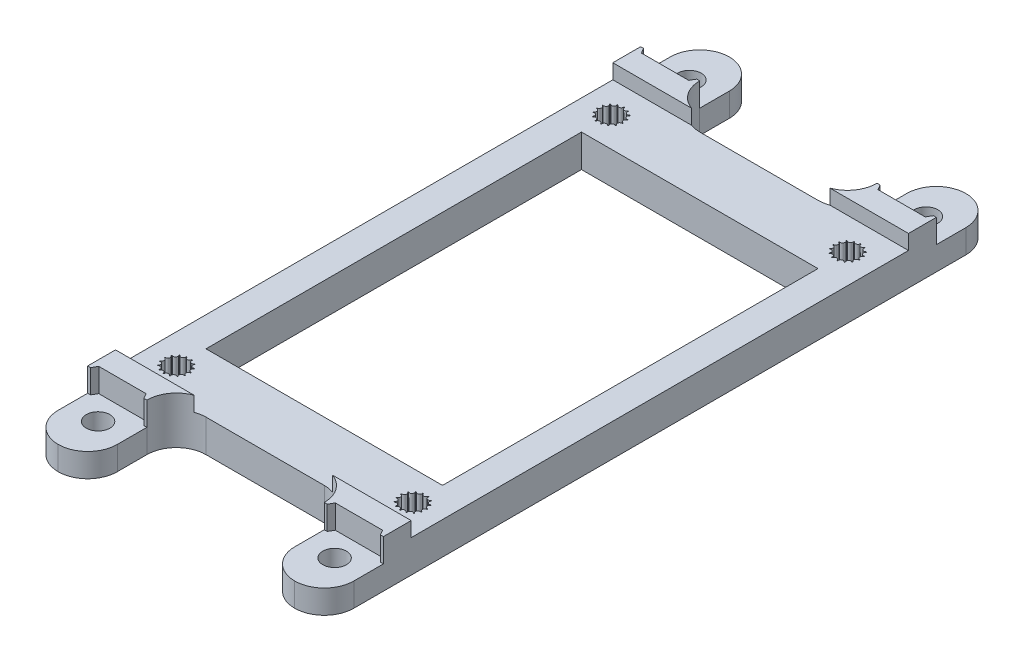
from build123d import *

# Parameters (mm, degrees)
SKETCH1_W                                  = 50
SKETCH1_H                                  = 83.5
BOSS_EXTRUDE1_DEPTH                        = 8
CUT_EXTRUDE1_DEPTH                         = 8
MIRROR1_AT_THE_SECOND_PLANE_COPY_1_DEPTH   = 8
SKETCH3_W                                  = 10
SKETCH3_H                                  = 15
SKETCH3_R                                  = 2
BOSS_EXTRUDE2_DEPTH                        = 8
MIRROR2_AT_THE_SECOND_PLANE_COPY_1_SKETC_W = 10
MIRROR2_AT_THE_SECOND_PLANE_COPY_1_SKETC_H = 15
MIRROR2_AT_THE_SECOND_PLANE_COPY_1_SKETC_R = 2
MIRROR2_AT_THE_SECOND_PLANE_COPY_1_DEPTH   = 8
FILLET1_R                                  = 5
CUT_EXTRUDE2_DEPTH                         = 4
MIRROR4_AT_THE_SECOND_PLANE_COPY_1_DEPTH   = 4
SKETCH5_W                                  = 40
SKETCH5_H                                  = 63.5
CUT_EXTRUDE3_DEPTH                         = 13
SKETCH6_W                                  = 51.1
SKETCH6_H                                  = 84.1
CUT_EXTRUDE4_DEPTH                         = 2.5


with BuildPart() as part:
    # Sketch1 → Boss-Extrude1 (new body)
    with BuildSketch(Plane(origin=(0, 0, 0), x_dir=(1, 0, 0), z_dir=(0, 1, 0))):
        with Locations((25, 41.75)):
            Rectangle(SKETCH1_W, SKETCH1_H)
    extrude(amount=BOSS_EXTRUDE1_DEPTH)

    # Sketch2 → Cut-Extrude1 (cut)
    with BuildSketch(Plane(origin=(0, 8, 0), x_dir=(1, 0, 0), z_dir=(0, 1, 0))):
        with BuildLine():
            ThreePointArc((7.160667609, 4.372293474), (6.839865506, 4.806622343), (7.243959363, 5.164761577))
            ThreePointArc((7.243959363, 5.164761577), (7.237674265, 5.235189042), (7.229179325, 5.305384245))
            ThreePointArc((7.229179325, 5.305384245), (6.759454555, 5.57168144), (6.982944313, 6.063217688))
            ThreePointArc((6.982944313, 6.063217688), (6.948557159, 6.125), (6.912245684, 6.185671305))
            ThreePointArc((6.912245684, 6.185671305), (6.374817927, 6.237891622), (6.379060176, 6.777833803))
            ThreePointArc((6.379060176, 6.777833803), (6.322516818, 6.820288237), (6.264667392, 6.860945025))
            ThreePointArc((6.264667392, 6.860945025), (5.75246279, 6.690059097), (5.536724007, 7.185046302))
            ThreePointArc((5.536724007, 7.185046302), (5.467801304, 7.200832102), (5.398416619, 7.214444444))
            ThreePointArc((5.398416619, 7.214444444), (5, 6.85), (4.601583381, 7.214444444))
            ThreePointArc((4.601583381, 7.214444444), (4.532198696, 7.200832102), (4.463275993, 7.185046302))
            ThreePointArc((4.463275993, 7.185046302), (4.479414078, 7.121153089), (4.484842553, 7.05547728))
            ThreePointArc((4.484842553, 7.05547728), (4.185331413, 6.668305497), (3.735332608, 6.860945025))
            ThreePointArc((3.735332608, 6.860945025), (3.677483182, 6.820288237), (3.620939824, 6.777833803))
            ThreePointArc((3.620939824, 6.777833803), (3.700218564, 6.651820533), (3.727924143, 6.505543864))
            ThreePointArc((3.727924143, 6.505543864), (3.50671462, 6.147725523), (3.087754316, 6.185671305))
            ThreePointArc((3.087754316, 6.185671305), (3.051442841, 6.125), (3.017055687, 6.063217688))
            ThreePointArc((3.017055687, 6.063217688), (3.193869104, 5.915772772), (3.260122838, 5.695288237))
            ThreePointArc((3.260122838, 5.695288237), (3.109400931, 5.382461716), (2.770820675, 5.305384245))
            ThreePointArc((2.770820675, 5.305384245), (2.762325735, 5.235189042), (2.756040637, 5.164761577))
            ThreePointArc((2.756040637, 5.164761577), (3.042937532, 5.049867127), (3.162325735, 4.764810958))
            ThreePointArc((3.162325735, 4.764810958), (3.071196794, 4.510648276), (2.839332391, 4.372293474))
            ThreePointArc((2.839332391, 4.372293474), (2.860122838, 4.304711763), (2.883026546, 4.237816691))
            ThreePointArc((2.883026546, 4.237816691), (3.266656087, 4.212169481), (3.451442841, 3.875))
            ThreePointArc((3.451442841, 3.875), (3.40640772, 3.690609287), (3.281443165, 3.547738864))
            ThreePointArc((3.281443165, 3.547738864), (3.327924143, 3.494456136), (3.376056398, 3.442660224))
            ThreePointArc((3.376056398, 3.442660224), (3.817892025, 3.554258631), (4.077483182, 3.179711763))
            ThreePointArc((4.077483182, 3.179711763), (4.063028211, 3.073151777), (4.020708029, 2.974293398))
            ThreePointArc((4.020708029, 2.974293398), (4.084842553, 2.94452272), (4.149880851, 2.916781953))
            ThreePointArc((4.149880851, 2.916781953), (4.591666595, 3.194722659), (4.932198696, 2.799167898))
            ThreePointArc((4.932198696, 2.799167898), (4.931473708, 2.775095823), (4.929301372, 2.751111007))
            ThreePointArc((4.929301372, 2.751111007), (5, 2.75), (5.070698628, 2.751111007))
            ThreePointArc((5.070698628, 2.751111007), (5.384636628, 3.190426939), (5.850119149, 2.916781953))
            ThreePointArc((5.850119149, 2.916781953), (5.915157447, 2.94452272), (5.979291971, 2.974293398))
            ThreePointArc((5.979291971, 2.974293398), (6.087402717, 3.50331856), (6.623943602, 3.442660224))
            ThreePointArc((6.623943602, 3.442660224), (6.672075857, 3.494456136), (6.718556835, 3.547738864))
            ThreePointArc((6.718556835, 3.547738864), (6.602146997, 4.075), (7.116973454, 4.237816691))
            ThreePointArc((7.116973454, 4.237816691), (7.139877162, 4.304711763), (7.160667609, 4.372293474))
        make_face()
    cut_extrude1 = extrude(amount=-CUT_EXTRUDE1_DEPTH, mode=Mode.SUBTRACT)

    # Mirror1: Cut-Extrude1 across plane
    add(cut_extrude1.mirror(Plane(origin=(0, 0, -41.75), x_dir=(1, 0, 0), z_dir=(0, 0, -1))), mode=Mode.SUBTRACT)

    # Mirror1 at the second plane: Cut-Extrude1 across plane
    add(cut_extrude1.mirror(Plane.ZY.offset(-25)), mode=Mode.SUBTRACT)

    # Mirror1 at the second plane copy 1 sketc → Mirror1 at the second plane copy 1 (cut)
    with BuildSketch(Plane(origin=(50, 8, -83.5), x_dir=(-1, 0, 0), z_dir=(0, 1, 0))):
        with BuildLine():
            ThreePointArc((7.160667609, 4.372293474), (6.839865506, 4.806622343), (7.243959363, 5.164761577))
            ThreePointArc((7.243959363, 5.164761577), (7.237674265, 5.235189042), (7.229179325, 5.305384245))
            ThreePointArc((7.229179325, 5.305384245), (6.759454555, 5.57168144), (6.982944313, 6.063217688))
            ThreePointArc((6.982944313, 6.063217688), (6.948557159, 6.125), (6.912245684, 6.185671305))
            ThreePointArc((6.912245684, 6.185671305), (6.374817927, 6.237891622), (6.379060176, 6.777833803))
            ThreePointArc((6.379060176, 6.777833803), (6.322516818, 6.820288237), (6.264667392, 6.860945025))
            ThreePointArc((6.264667392, 6.860945025), (5.75246279, 6.690059097), (5.536724007, 7.185046302))
            ThreePointArc((5.536724007, 7.185046302), (5.467801304, 7.200832102), (5.398416619, 7.214444444))
            ThreePointArc((5.398416619, 7.214444444), (5, 6.85), (4.601583381, 7.214444444))
            ThreePointArc((4.601583381, 7.214444444), (4.532198696, 7.200832102), (4.463275993, 7.185046302))
            ThreePointArc((4.463275993, 7.185046302), (4.479414078, 7.121153089), (4.484842553, 7.05547728))
            ThreePointArc((4.484842553, 7.05547728), (4.185331413, 6.668305497), (3.735332608, 6.860945025))
            ThreePointArc((3.735332608, 6.860945025), (3.677483182, 6.820288237), (3.620939824, 6.777833803))
            ThreePointArc((3.620939824, 6.777833803), (3.700218564, 6.651820533), (3.727924143, 6.505543864))
            ThreePointArc((3.727924143, 6.505543864), (3.50671462, 6.147725523), (3.087754316, 6.185671305))
            ThreePointArc((3.087754316, 6.185671305), (3.051442841, 6.125), (3.017055687, 6.063217688))
            ThreePointArc((3.017055687, 6.063217688), (3.193869104, 5.915772772), (3.260122838, 5.695288237))
            ThreePointArc((3.260122838, 5.695288237), (3.109400931, 5.382461716), (2.770820675, 5.305384245))
            ThreePointArc((2.770820675, 5.305384245), (2.762325735, 5.235189042), (2.756040637, 5.164761577))
            ThreePointArc((2.756040637, 5.164761577), (3.042937532, 5.049867127), (3.162325735, 4.764810958))
            ThreePointArc((3.162325735, 4.764810958), (3.071196794, 4.510648276), (2.839332391, 4.372293474))
            ThreePointArc((2.839332391, 4.372293474), (2.860122838, 4.304711763), (2.883026546, 4.237816691))
            ThreePointArc((2.883026546, 4.237816691), (3.266656087, 4.212169481), (3.451442841, 3.875))
            ThreePointArc((3.451442841, 3.875), (3.40640772, 3.690609287), (3.281443165, 3.547738864))
            ThreePointArc((3.281443165, 3.547738864), (3.327924143, 3.494456136), (3.376056398, 3.442660224))
            ThreePointArc((3.376056398, 3.442660224), (3.817892025, 3.554258631), (4.077483182, 3.179711763))
            ThreePointArc((4.077483182, 3.179711763), (4.063028211, 3.073151777), (4.020708029, 2.974293398))
            ThreePointArc((4.020708029, 2.974293398), (4.084842553, 2.94452272), (4.149880851, 2.916781953))
            ThreePointArc((4.149880851, 2.916781953), (4.591666595, 3.194722659), (4.932198696, 2.799167898))
            ThreePointArc((4.932198696, 2.799167898), (4.931473708, 2.775095823), (4.929301372, 2.751111007))
            ThreePointArc((4.929301372, 2.751111007), (5, 2.75), (5.070698628, 2.751111007))
            ThreePointArc((5.070698628, 2.751111007), (5.384636628, 3.190426939), (5.850119149, 2.916781953))
            ThreePointArc((5.850119149, 2.916781953), (5.915157447, 2.94452272), (5.979291971, 2.974293398))
            ThreePointArc((5.979291971, 2.974293398), (6.087402717, 3.50331856), (6.623943602, 3.442660224))
            ThreePointArc((6.623943602, 3.442660224), (6.672075857, 3.494456136), (6.718556835, 3.547738864))
            ThreePointArc((6.718556835, 3.547738864), (6.602146997, 4.075), (7.116973454, 4.237816691))
            ThreePointArc((7.116973454, 4.237816691), (7.139877162, 4.304711763), (7.160667609, 4.372293474))
        make_face()
    extrude(amount=-MIRROR1_AT_THE_SECOND_PLANE_COPY_1_DEPTH, mode=Mode.SUBTRACT)

    # Sketch3 → Boss-Extrude2 (add)
    with BuildSketch(Plane(origin=(0, 8, 0), x_dir=(1, 0, 0), z_dir=(0, 1, 0))):
        with Locations((5, -7.5)):
            Rectangle(SKETCH3_W, SKETCH3_H)
        with Locations(Location((5, -8.25, 0), (0, 0, 270))):
            Circle(SKETCH3_R, mode=Mode.SUBTRACT)
    boss_extrude2 = extrude(amount=-BOSS_EXTRUDE2_DEPTH)

    # Mirror2: Boss-Extrude2 across plane
    add(boss_extrude2.mirror(Plane(origin=(0, 0, -41.75), x_dir=(1, 0, 0), z_dir=(0, 0, -1))))

    # Mirror2 at the second plane: Boss-Extrude2 across plane
    add(boss_extrude2.mirror(Plane.ZY.offset(-25)))

    # Mirror2 at the second plane copy 1 sketc → Mirror2 at the second plane copy 1 (add)
    with BuildSketch(Plane(origin=(50, 8, -83.5), x_dir=(-1, 0, 0), z_dir=(0, 1, 0))):
        with Locations((5, -7.5)):
            Rectangle(MIRROR2_AT_THE_SECOND_PLANE_COPY_1_SKETC_W, MIRROR2_AT_THE_SECOND_PLANE_COPY_1_SKETC_H)
        with Locations(Location((5, -8.25, 0), (0, 0, 270))):
            Circle(MIRROR2_AT_THE_SECOND_PLANE_COPY_1_SKETC_R, mode=Mode.SUBTRACT)
    extrude(amount=-MIRROR2_AT_THE_SECOND_PLANE_COPY_1_DEPTH)

    # Fillet1
    fillet1_edges = [part.edges().sort_by_distance(p)[0] for p in [
        (0, 4, 15),
        (10, 4, 0),
        (10, 4, 15),
        (50, 4, 15),
        (40, 4, 15),
        (40, 4, 0),
        (0, 4, -98.5),
        (10, 4, -98.5),
        (10, 4, -83.5),
        (50, 4, -98.5),
        (40, 4, -83.5),
        (40, 4, -98.5),
    ]]
    fillet(fillet1_edges, radius=FILLET1_R - 0.0001)  # a hair under: the kernel refuses the full size

    # Sketch4 → Cut-Extrude2 (cut)
    with BuildSketch(Plane(origin=(0, 8, 0), x_dir=(1, 0, 0), z_dir=(0, 1, 0))):
        Polygon((1, -4.133974596), (0.5, -5), (0, -5), (0, -18.620495432), (15, -18.620495432), (15, -5), (9.5, -5), (9, -4.133974596), align=None)
    cut_extrude2 = extrude(amount=-CUT_EXTRUDE2_DEPTH, mode=Mode.SUBTRACT)

    # Mirror4: Cut-Extrude2 across plane
    add(cut_extrude2.mirror(Plane(origin=(0, 0, -41.75), x_dir=(1, 0, 0), z_dir=(0, 0, -1))), mode=Mode.SUBTRACT)

    # Mirror4 at the second plane: Cut-Extrude2 across plane
    add(cut_extrude2.mirror(Plane.ZY.offset(-25)), mode=Mode.SUBTRACT)

    # Mirror4 at the second plane copy 1 sketc → Mirror4 at the second plane copy 1 (cut)
    with BuildSketch(Plane(origin=(50, 8, -83.5), x_dir=(-1, 0, 0), z_dir=(0, 1, 0))):
        Polygon((1, -4.133974596), (0.5, -5), (0, -5), (0, -18.620495432), (15, -18.620495432), (15, -5), (9.5, -5), (9, -4.133974596), align=None)
    extrude(amount=-MIRROR4_AT_THE_SECOND_PLANE_COPY_1_DEPTH, mode=Mode.SUBTRACT)

    # Sketch5 → Cut-Extrude3 (cut)
    with BuildSketch(Plane(origin=(0, 8, 0), x_dir=(1, 0, 0), z_dir=(0, 1, 0))):
        with Locations((25, 41.75)):
            Rectangle(SKETCH5_W, SKETCH5_H)
    extrude(amount=-CUT_EXTRUDE3_DEPTH, mode=Mode.SUBTRACT)

    # Sketch6 → Cut-Extrude4 (cut)
    with BuildSketch(Plane(origin=(0, 8, 0), x_dir=(1, 0, 0), z_dir=(0, 1, 0))):
        with Locations((25, 41.75)):
            Rectangle(SKETCH6_W, SKETCH6_H)
    extrude(amount=-CUT_EXTRUDE4_DEPTH, mode=Mode.SUBTRACT)


solid = part.part
